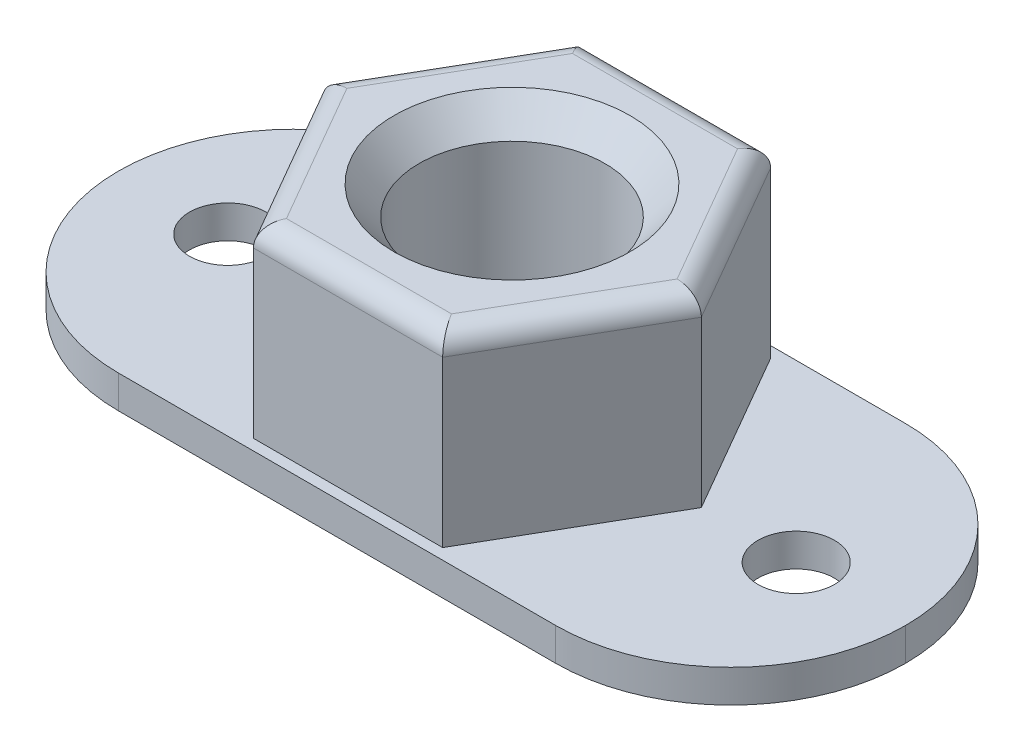
from build123d import *

# Parameters (mm, degrees)
BOSS_EXTRUDE1_DEPTH               = 13.49375
F_5_8_11_TAPPED_HOLE1_D           = 13.49248
F_5_8_11_TAPPED_HOLE1_CSINK_D     = 17.145
F_5_8_11_TAPPED_HOLE1_CSINK_ANGLE = 82
FILLET1_R                         = 1.524
SKETCH4_W                         = 57.15
SKETCH4_H                         = 25.4
BOSS_EXTRUDE2_DEPTH               = 2.38125
FILLET2_R                         = 12.7
SKETCH5_R                         = 9.525
CUT_EXTRUDE1_DEPTH                = 2.38125
SKETCH6_R                         = 2.778125
CUT_EXTRUDE2_DEPTH                = 36.06902123


with BuildPart() as part:
    # Sketch1 → Boss-Extrude1 (new body)
    with BuildSketch(Plane(origin=(0, 0, 0), x_dir=(1, 0, 0), z_dir=(0, 1, 0))):
        Polygon((13.748153285, 0), (6.874076643, 11.90625), (-6.874076643, 11.90625), (-13.748153285, 0), (-6.874076643, -11.90625), (6.874076643, -11.90625), align=None)
    extrude(amount=BOSS_EXTRUDE1_DEPTH)

    # 5/8-11 Tapped Hole1 (through all)
    with Locations(Plane(origin=(0, 13.49375, 0), x_dir=(1, 0, 0), z_dir=(0, 1, 0))):
        with Locations((0, 0)):
            CounterSinkHole(F_5_8_11_TAPPED_HOLE1_D / 2, F_5_8_11_TAPPED_HOLE1_CSINK_D / 2, counter_sink_angle=F_5_8_11_TAPPED_HOLE1_CSINK_ANGLE)

    # Fillet1
    fillet1_edges = [part.edges().sort_by_distance(p)[0] for p in [
        (0, 13.49375, -11.90625),
        (-10.311114964, 13.49375, -5.953125),
        (-10.311114964, 13.49375, 5.953125),
        (0, 13.49375, 11.90625),
        (10.311114964, 13.49375, 5.953125),
        (10.311114964, 13.49375, -5.953125),
    ]]
    fillet(fillet1_edges, radius=FILLET1_R)

    # Sketch4 → Boss-Extrude2 (add)
    with BuildSketch(Plane.XZ):
        Rectangle(SKETCH4_W, SKETCH4_H)
    extrude(amount=BOSS_EXTRUDE2_DEPTH)

    # Fillet2
    fillet2_edges = [part.edges().sort_by_distance(p)[0] for p in [
        (-28.575, -1.190625, -12.7),
        (-28.575, -1.190625, 12.7),
        (28.575, -1.190625, -12.7),
        (28.575, -1.190625, 12.7),
    ]]
    fillet(fillet2_edges, radius=FILLET2_R - 0.0001)  # a hair under: the kernel refuses the full size

    # Sketch5 → Cut-Extrude1 (cut)
    with BuildSketch(Plane.XZ.offset(2.38125)):
        with Locations(Location((0, 0, 0), (0, 0, 270))):
            Circle(SKETCH5_R)
    extrude(amount=-CUT_EXTRUDE1_DEPTH, mode=Mode.SUBTRACT)

    # Sketch6 → Cut-Extrude2 (cut, through all)
    with BuildSketch(Plane.XZ.offset(2.38125)):
        with Locations(Location((-20.6375, 0, 0), (0, 0, 270))):
            Circle(SKETCH6_R)
        with Locations(Location((20.6375, 0, 0), (0, 0, 270))):
            Circle(SKETCH6_R)
    extrude(amount=-CUT_EXTRUDE2_DEPTH, mode=Mode.SUBTRACT)


solid = part.part
